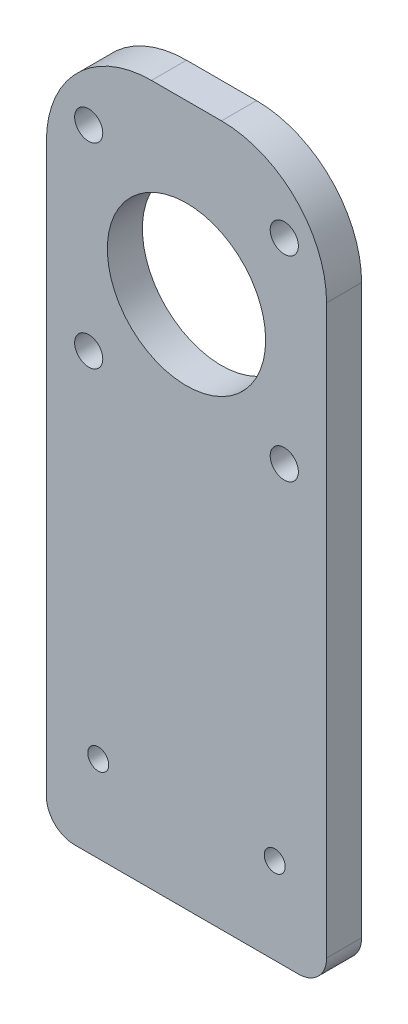
from build123d import *

# Parameters (mm, degrees)
SKETCH2_W           = 50.8
SKETCH2_H           = 127
SKETCH2_R           = 14.351
SKETCH2_R_2         = 2.5527
SKETCH2_R_3         = 1.905
BOSS_EXTRUDE3_DEPTH = 6.35
FILLET1_R           = 19.05
FILLET4_R           = 19.05
FILLET5_R           = 5.08


with BuildPart() as part:
    # Sketch2 → Boss-Extrude3 (new body)
    with BuildSketch(Plane.XY):
        with Locations((25.4, 63.5)):
            Rectangle(SKETCH2_W, SKETCH2_H)
        with Locations((25.4, 96.5708)):
            Circle(SKETCH2_R, mode=Mode.SUBTRACT)
        with Locations((43.1292, 114.3)):
            Circle(SKETCH2_R_2, mode=Mode.SUBTRACT)
        with Locations((7.6708, 114.3)):
            Circle(SKETCH2_R_2, mode=Mode.SUBTRACT)
        with Locations((7.6708, 78.8416)):
            Circle(SKETCH2_R_2, mode=Mode.SUBTRACT)
        with Locations((43.1292, 78.8416)):
            Circle(SKETCH2_R_2, mode=Mode.SUBTRACT)
        with Locations((41.4, 15.636322387)):
            Circle(SKETCH2_R_3, mode=Mode.SUBTRACT)
        with Locations((9.4, 15.636322387)):
            Circle(SKETCH2_R_3, mode=Mode.SUBTRACT)
    extrude(amount=BOSS_EXTRUDE3_DEPTH)

    # Fillet1
    fillet1_edges = [part.edges().sort_by_distance(p)[0] for p in [
        (50.8, 127, 3.175),
    ]]
    fillet(fillet1_edges, radius=FILLET1_R)

    # Fillet4
    fillet4_edges = [part.edges().sort_by_distance(p)[0] for p in [
        (0, 127, 3.175),
    ]]
    fillet(fillet4_edges, radius=FILLET4_R)

    # Fillet5
    fillet5_edges = [part.edges().sort_by_distance(p)[0] for p in [
        (0, 0, 3.175),
        (50.8, 0, 3.175),
    ]]
    fillet(fillet5_edges, radius=FILLET5_R)


solid = part.part
